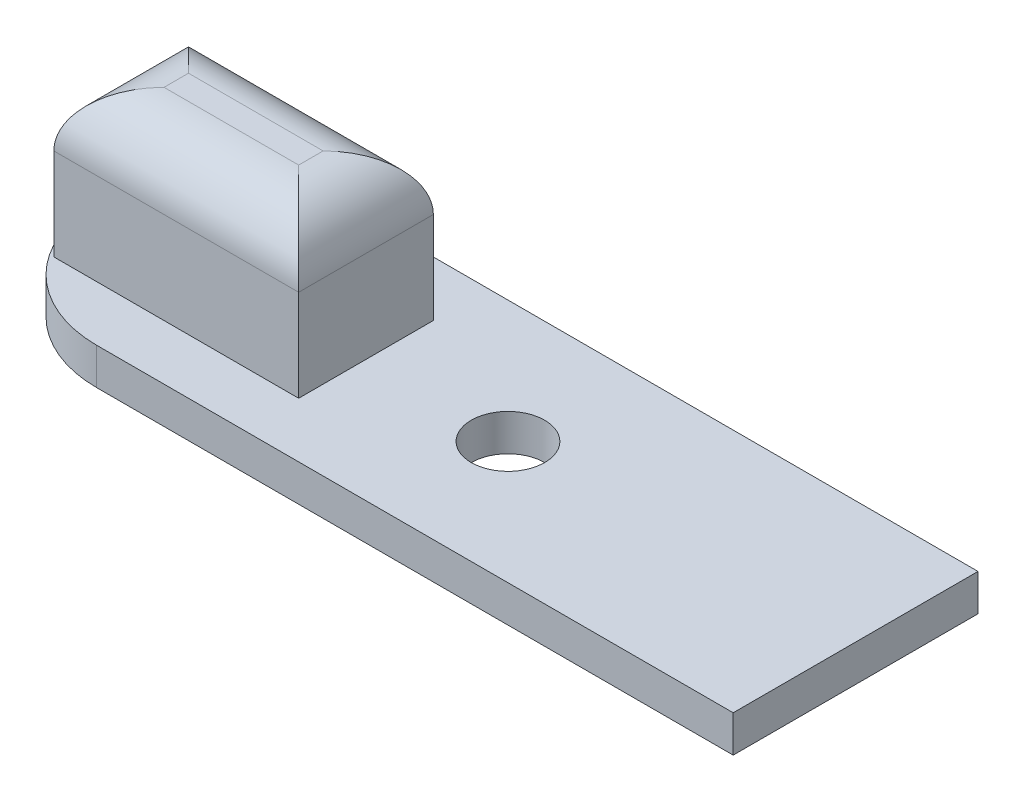
from build123d import *

# Parameters (mm, degrees)
SKETCH1_W           = 31
SKETCH1_H           = 10
BOSS_EXTRUDE1_DEPTH = 1.5
CUT_EXTRUDE1_REACH  = 34.608
SKETCH2_R           = 1.5
SKETCH3_W           = 10
SKETCH3_H           = 5.5
BOSS_EXTRUDE2_DEPTH = 6
FILLET3_R           = 2.25
FILLET4_R           = 5


with BuildPart() as part:
    # Sketch1 → Boss-Extrude1 (new body)
    with BuildSketch(Plane(origin=(0, 0, 0), x_dir=(1, 0, 0), z_dir=(0, 1, 0))):
        with Locations((-15.5, 5)):
            Rectangle(SKETCH1_W, SKETCH1_H)
    extrude(amount=BOSS_EXTRUDE1_DEPTH)

    # Sketch2 → Cut-Extrude1 (cut, up to next)
    with BuildSketch(Plane(origin=(0, 1.5, 0), x_dir=(1, 0, 0), z_dir=(0, 1, 0)), mode=Mode.PRIVATE) as cut_extrude1_sk1:
        with Locations(Location((-14.2, 5, 0), (0, 0, 270))):
            Circle(SKETCH2_R)
    cut_extrude1_tool1 = extrude(cut_extrude1_sk1.sketch, amount=-CUT_EXTRUDE1_REACH, mode=Mode.PRIVATE) & part.part
    add(cut_extrude1_tool1.solids().sort_by_distance((-14.2, 1.5, -5))[0], mode=Mode.SUBTRACT)

    # Sketch3 → Boss-Extrude2 (add)
    with BuildSketch(Plane(origin=(0, 1.5, 0), x_dir=(1, 0, 0), z_dir=(0, 1, 0))):
        with Locations((-25, 5)):
            Rectangle(SKETCH3_W, SKETCH3_H)
    extrude(amount=BOSS_EXTRUDE2_DEPTH)

    # Fillet3
    fillet3_edges = [part.edges().sort_by_distance(p)[0] for p in [
        (-30, 7.5, -5),
        (-25, 7.5, -2.25),
        (-20, 7.5, -5),
        (-25, 7.5, -7.75),
    ]]
    fillet(fillet3_edges, radius=FILLET3_R)

    # Fillet4
    fillet4_edges = [part.edges().sort_by_distance(p)[0] for p in [
        (-31, 0.75, 0),
        (-31, 0.75, -10),
    ]]
    fillet(fillet4_edges, radius=FILLET4_R - 0.0001)  # a hair under: the kernel refuses the full size


solid = part.part
